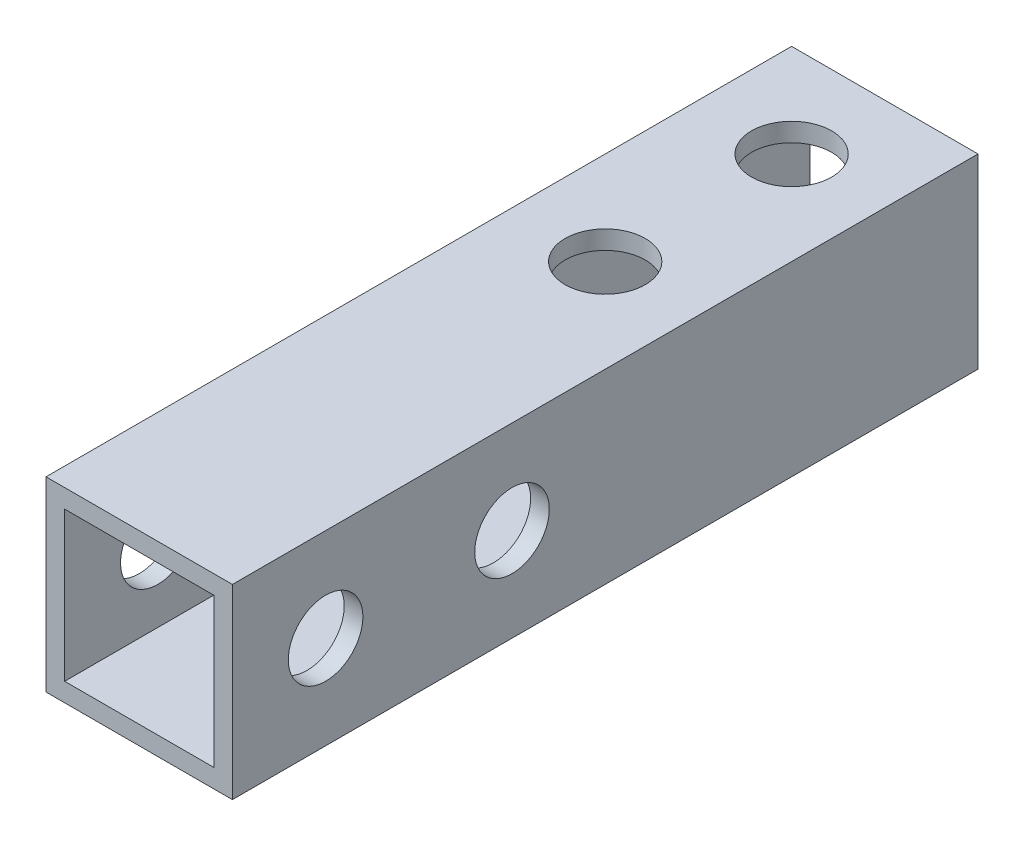
from build123d import *

# Parameters (mm, degrees)
SKETCH_1_W          = 10
SKETCH_1_H          = 10
SKETCH_1_W_2        = 8
SKETCH_1_H_2        = 8
EXTRUDE_1_DEPTH     = 40
SKETCH_2_R          = 2.15
CUT_EXTRUDE_1_DEPTH = 42.533119315
SKETCH_3_R          = 2
CUT_EXTRUDE_2_DEPTH = 42.533119315


with BuildPart() as part:
    # ｽｹｯﾁ1 → 押し出し-薄板1 (new body)
    with BuildSketch(Plane.XY):
        Rectangle(SKETCH_1_W, SKETCH_1_H)
        Rectangle(SKETCH_1_W_2, SKETCH_1_H_2, mode=Mode.SUBTRACT)
    extrude(amount=EXTRUDE_1_DEPTH)

    # ｽｹｯﾁ2 → ｶｯﾄ - 押し出し1 (cut, through all)
    with BuildSketch(Plane(origin=(0, 5, 0), x_dir=(1, 0, 0), z_dir=(0, 1, 0))):
        with Locations((0, -15)):
            Circle(SKETCH_2_R)
        with Locations((0, -5)):
            Circle(SKETCH_2_R)
    extrude(amount=-CUT_EXTRUDE_1_DEPTH, mode=Mode.SUBTRACT)

    # ｽｹｯﾁ3 → ｶｯﾄ - 押し出し2 (cut, through all)
    with BuildSketch(Plane(origin=(5, 0, 0), x_dir=(0, 0, -1), z_dir=(1, 0, 0))):
        with Locations((-25, 0)):
            Circle(SKETCH_3_R)
        with Locations((-35, 0)):
            Circle(SKETCH_3_R)
    extrude(amount=-CUT_EXTRUDE_2_DEPTH, mode=Mode.SUBTRACT)


solid = part.part
